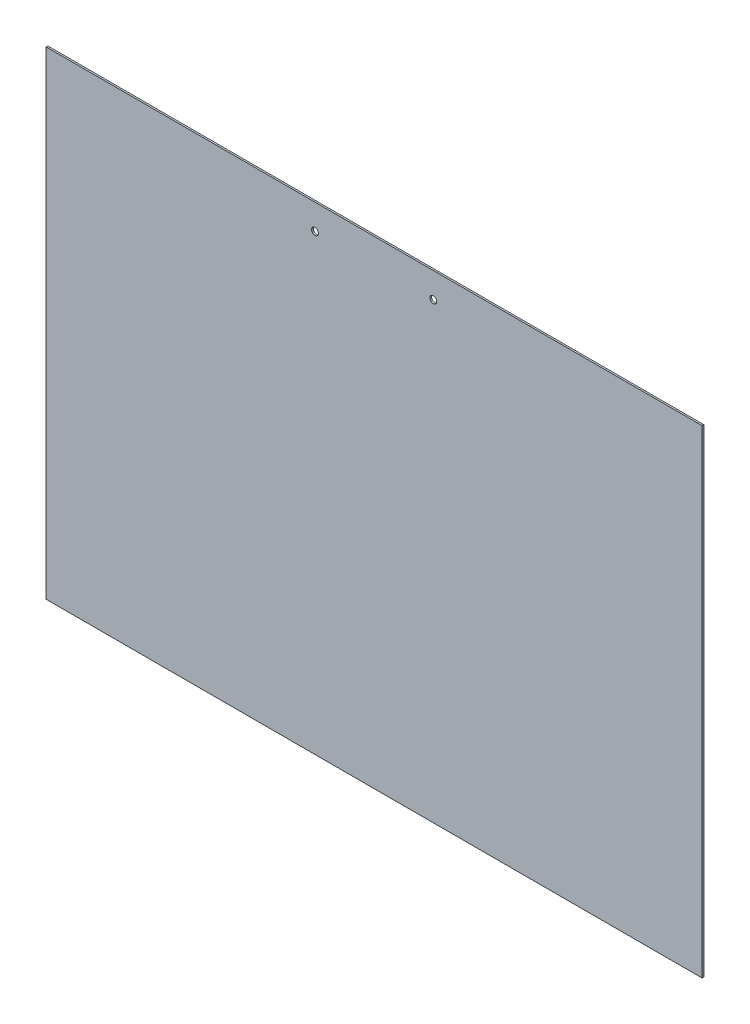
from build123d import *

# Parameters (mm, degrees)
SKETCH1_W           = 388
SKETCH1_H           = 283
SKETCH1_R           = 2
BOSS_EXTRUDE1_DEPTH = 1


with BuildPart() as part:
    # Sketch1 → Boss-Extrude1 (new body)
    with BuildSketch(Plane.XY):
        Rectangle(SKETCH1_W, SKETCH1_H)
        with Locations((-35, 126.5)):
            Circle(SKETCH1_R, mode=Mode.SUBTRACT)
        with Locations((35, 126.5)):
            Circle(SKETCH1_R, mode=Mode.SUBTRACT)
    extrude(amount=BOSS_EXTRUDE1_DEPTH)


solid = part.part
